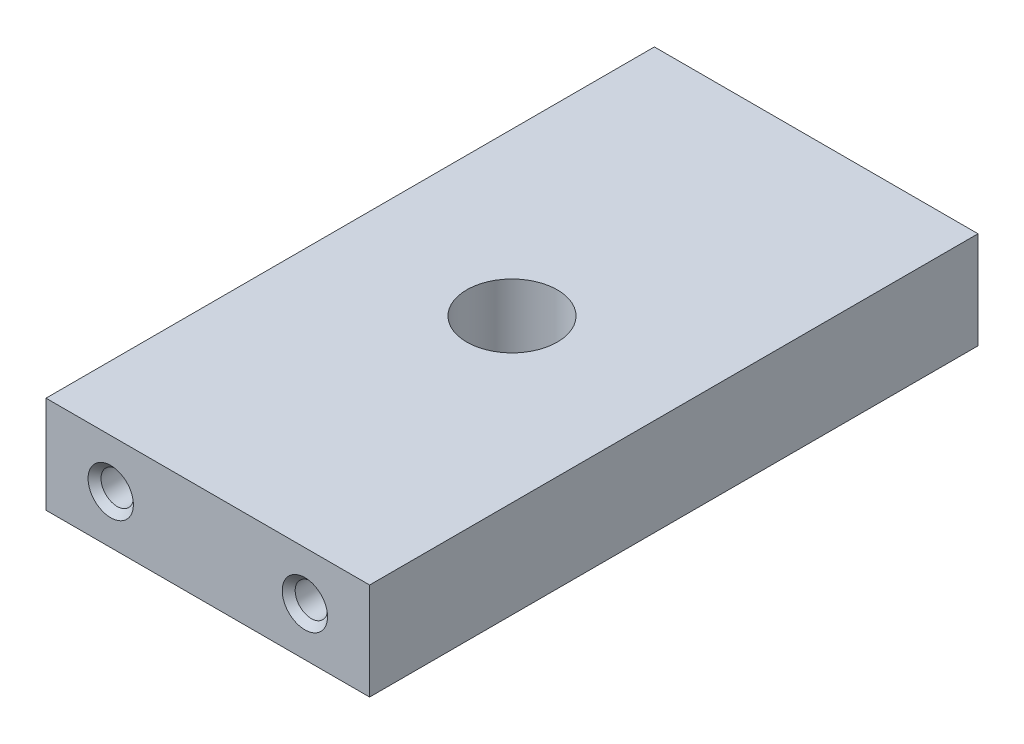
from build123d import *

# Parameters (mm, degrees)
SZKIC1_W                    = 50
SZKIC1_H                    = 15
DODANIE_WYCI_GNI_CIE1_DEPTH = 47
SZKIC2_R                    = 2.5
WYTNIJ_WYCI_GNI_CIE1_DEPTH  = 20
LUSTRO1_START               = 47
LUSTRO1_OUTLINE_W           = 50
LUSTRO1_OUTLINE_H           = 15
LUSTRO1_OUTLINE_R           = 2.5
LUSTRO1_DEPTH               = 47
LUSTRO1_2_OUTLINE_R         = 2.5
LUSTRO1_2_DEPTH             = 27
SZKIC5_R                    = 7
WYTNIJ_WYCI_GNI_CIE2_DEPTH  = 108.522090753
SFAZOWANIE2_SIZE            = 1


# Read off the part's stored shape, not the designer's step: Lustro1
with BuildPart() as part:
    # Szkic1 → Dodanie-wyciągnięcie1 (new body)
    with BuildSketch(Plane.XY):
        with Locations((25, 7.5)):
            Rectangle(SZKIC1_W, SZKIC1_H)
    extrude(amount=DODANIE_WYCI_GNI_CIE1_DEPTH)

    # Szkic2 → Wytnij-wyciągnięcie1 (cut)
    with BuildSketch(Plane(origin=(0, 0, 0), x_dir=(-1, 0, 0), z_dir=(0, 0, -1))):
        with Locations((-40, 7.5)):
            Circle(SZKIC2_R)
        with Locations((-10, 7.5)):
            Circle(SZKIC2_R)
    extrude(amount=-WYTNIJ_WYCI_GNI_CIE1_DEPTH, mode=Mode.SUBTRACT)

    # Lustro1 outline → Lustro1 (add)
    with BuildSketch(Plane.XY.offset(LUSTRO1_START)):
        with Locations((25, 7.5)):
            Rectangle(LUSTRO1_OUTLINE_W, LUSTRO1_OUTLINE_H)
        with Locations((10, 7.5)):
            Circle(LUSTRO1_OUTLINE_R, mode=Mode.SUBTRACT)
        with Locations((40, 7.5)):
            Circle(LUSTRO1_OUTLINE_R, mode=Mode.SUBTRACT)
    extrude(amount=LUSTRO1_DEPTH)

    # Lustro1 2 outline → Lustro1 2 (add)
    with BuildSketch(Plane.XY.offset(LUSTRO1_START)):
        with Locations((10, 7.5)):
            Circle(LUSTRO1_2_OUTLINE_R)
        with Locations((40, 7.5)):
            Circle(LUSTRO1_2_OUTLINE_R)
    extrude(amount=LUSTRO1_2_DEPTH)

    # Szkic5 → Wytnij-wyciągnięcie2 (cut, through all)
    with BuildSketch(Plane(origin=(0, 15, 0), x_dir=(1, 0, 0), z_dir=(0, 1, 0))):
        with Locations(Location((25, -47, 0), (0, 0, 270))):
            Circle(SZKIC5_R)
    extrude(amount=-WYTNIJ_WYCI_GNI_CIE2_DEPTH, mode=Mode.SUBTRACT)

    # Sfazowanie2
    sfazowanie2_edges = [part.edges().sort_by_distance(p)[0] for p in [
        (42.5, 7.5, 0),
        (12.5, 7.5, 0),
        (37.5, 7.5, 94),
        (7.5, 7.5, 94),
    ]]
    chamfer(sfazowanie2_edges, length=SFAZOWANIE2_SIZE)


solid = part.part
